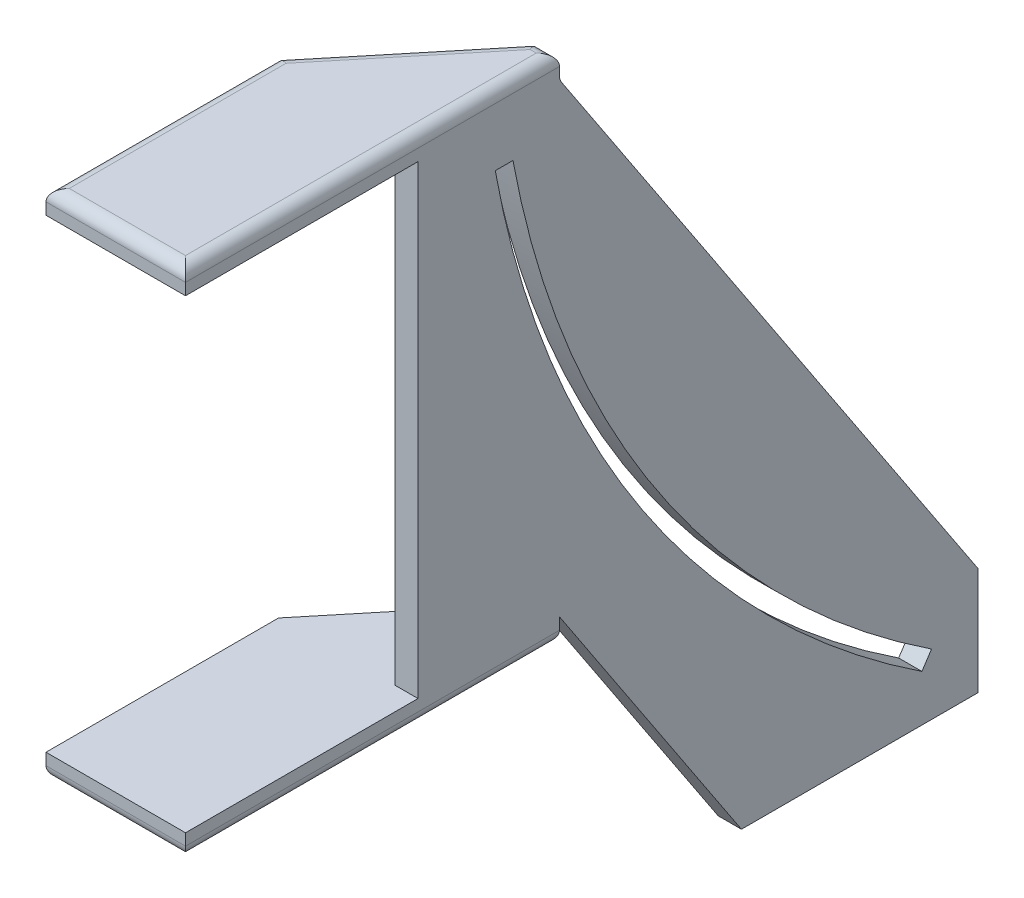
from build123d import *

# Parameters (mm, degrees)
BOSS_EXTRUDE1_DEPTH = 3.175
BOSS_EXTRUDE2_DEPTH = 3.175
FILLET1_R           = 1.5875
BOSS_EXTRUDE3_DEPTH = 3.175
FILLET2_R           = 1.5875


with BuildPart() as part:
    # Sketch1 → Boss-Extrude1 (new body)
    with BuildSketch(Plane(origin=(0, 0, 0), x_dir=(0, 0, -1), z_dir=(1, 0, 0))):
        Polygon((-123.554053147, -17.526), (-66.404053147, -103.885992991), (-66.404053147, -118.573420749), (-98.706493282, -118.573420749), (-123.554053147, -81.026), (-142.875, -81.026), (-142.875, -17.526), align=None)
        with BuildLine():
            Line((-132.324466277, -23.876), (-129.904053147, -23.876))
            ThreePointArc((-129.904053147, -23.876), (-110.14576301, -72.890584378), (-72.754053147, -110.235992991))
            Line((-72.754053147, -110.235992991), (-74.065724778, -112.223420749))
            ThreePointArc((-74.065724778, -112.223420749), (-112.252146658, -74.022181286), (-132.324466277, -23.876))
        make_face(mode=Mode.SUBTRACT)
    extrude(amount=BOSS_EXTRUDE1_DEPTH)

    # Sketch2 → Boss-Extrude2 (add)
    with BuildSketch(Plane(origin=(0, -17.526, 0), x_dir=(1, 0, 0), z_dir=(0, 1, 0))):
        Polygon((0, -123.554053147), (3.175, -123.554053147), (3.175, -174.625), (-15.875, -174.625), (-15.875, -142.875), align=None)
    extrude(amount=BOSS_EXTRUDE2_DEPTH)

    # Fillet1
    # the kernel refuses this fillet: 1.5875 mm, written as the material it adds along each edge
    with BuildSketch(Plane(origin=(0, -17.526, 123.554053147), x_dir=(0, -0.8339321851132224, -0.5518669319974573), z_dir=(1, 0, 0))) as fillet1_piece_1:
        with BuildLine():
            CenterArc((FILLET1_R * 0.300920032091, FILLET1_R), FILLET1_R, 236.504813186, 33.495186814)
            Line((-FILLET1_R * 0.250946899906, FILLET1_R * 0.166067814887), (0, 0))
            Line((0, 0), (FILLET1_R * 0.300920032091, 0))
        make_face()
    extrude(amount=3.175)
    # the kernel refuses this fillet: 1.5875 mm, written as the material it takes off along each edge
    with BuildSketch(Plane(origin=(-18.394522192, -14.351, 145.941428621), x_dir=(0.7726434320880118, 0, 0.6348402372654539), z_dir=(0.634840237265454, 0, -0.7726434320880119))) as fillet1_2_piece_1:
        with BuildLine():
            CenterArc((FILLET1_R, FILLET1_R), FILLET1_R, 180, 90)
            Line((0, FILLET1_R), (0, 0))
            Line((0, 0), (FILLET1_R, 0))
        make_face()
    extrude(amount=32.943791454, mode=Mode.SUBTRACT)
    with BuildSketch(Plane(origin=(-15.875, -14.351, 178.59375), x_dir=(1, 0, 0), z_dir=(0, 0, -1))) as fillet1_2_piece_2:
        with BuildLine():
            CenterArc((FILLET1_R, FILLET1_R), FILLET1_R, 180, 90)
            Line((0, FILLET1_R), (0, 0))
            Line((0, 0), (FILLET1_R, 0))
        make_face()
    extrude(amount=39.6875, mode=Mode.SUBTRACT)
    with BuildSketch(Plane(origin=(7.14375, -14.351, 174.625), x_dir=(0, -1, 0), z_dir=(-1, 0, 0))) as fillet1_2_piece_3:
        with BuildLine():
            CenterArc((FILLET1_R, -FILLET1_R), FILLET1_R, 90, 90)
            Line((0, -FILLET1_R), (0, 0))
            Line((0, 0), (FILLET1_R, 0))
        make_face()
    extrude(amount=26.9875, mode=Mode.SUBTRACT)
    with BuildSketch(Plane(origin=(3.175, -14.351, 119.585303147), x_dir=(0, -1, 0), z_dir=(0, 0, 1))) as fillet1_2_piece_4:
        with BuildLine():
            CenterArc((FILLET1_R, -FILLET1_R), FILLET1_R, 90, 90)
            Line((0, -FILLET1_R), (0, 0))
            Line((0, 0), (FILLET1_R, 0))
        make_face()
    extrude(amount=59.008446853, mode=Mode.SUBTRACT)
    with BuildSketch(Plane(origin=(-3.96875, -14.351, 123.554053147), x_dir=(0, 0, 1), z_dir=(1, 0, 0))) as fillet1_2_piece_5:
        with BuildLine():
            CenterArc((FILLET1_R, FILLET1_R), FILLET1_R, 180, 90)
            Line((0, FILLET1_R), (0, 0))
            Line((0, 0), (FILLET1_R, 0))
        make_face()
    extrude(amount=11.1125, mode=Mode.SUBTRACT)

    # Sketch4 → Boss-Extrude3 (add)
    with BuildSketch(Plane.XZ.offset(81.026)):
        Polygon((3.175, 123.554053147), (3.175, 174.625), (-15.875, 174.625), (-15.875, 142.875), (0, 123.554053147), align=None)
    extrude(amount=BOSS_EXTRUDE3_DEPTH)

    # Fillet2
    fillet2_edges = [part.edges().sort_by_distance(p)[0] for p in [
        (1.5875, -84.201, 123.554053147),
        (3.175, -84.201, 149.089526573),
        (-6.35, -84.201, 174.625),
        (-15.875, -84.201, 158.75),
        (-7.9375, -84.201, 133.214526573),
    ]]
    fillet(fillet2_edges, radius=FILLET2_R)


solid = part.part
